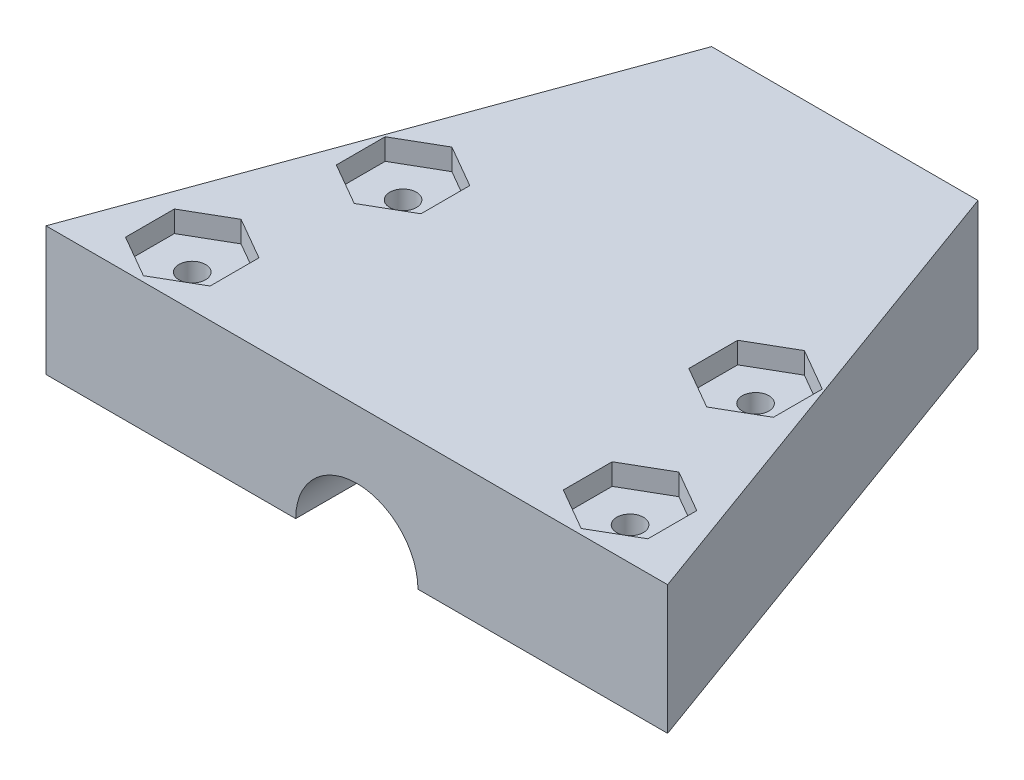
from build123d import *

# Parameters (mm, degrees)
BOSS_EXTRUDE3_DEPTH              = 14.5
SKETCH8_R                        = 6.884606738
CUT_EXTRUDE3_DEPTH               = 88
CUT_EXTRUDE4_DEPTH               = 2.4
CUT_EXTRUDE5_DEPTH               = 2.4
F_39_0_11811024_DIAMETER_HOLE1_D = 3.000000096


with BuildPart() as part:
    # Sketch6 → Boss-Extrude3 (new body)
    with BuildSketch(Plane(origin=(0, 0, 0), x_dir=(1, 0, 0), z_dir=(0, 1, 0))):
        Polygon((-16.836914056, 5.783353512), (13.163085944, 5.783353512), (33.163085944, -49.166194877), (-36.836914056, -49.166194877), align=None)
    extrude(amount=BOSS_EXTRUDE3_DEPTH)

    # Sketch8 → Cut-Extrude3 (cut)
    with BuildSketch(Plane.XY.offset(49.166194877)):
        with Locations((-1.836914056, 0)):
            Circle(SKETCH8_R)
    extrude(amount=-CUT_EXTRUDE3_DEPTH, mode=Mode.SUBTRACT)

    # Sketch9 → Cut-Extrude4 (cut)
    with BuildSketch(Plane(origin=(0, 14.5, 0), x_dir=(1, 0, 0), z_dir=(0, 1, 0))):
        Polygon((-21.661914056, -29.63287332), (-16.898774335, -26.88287332), (-16.898774335, -21.38287332), (-21.661914056, -18.63287332), (-26.425053777, -21.38287332), (-26.425053777, -26.88287332), align=None)
        Polygon((-26.486914056, -48.549100152), (-21.723774335, -45.799100152), (-21.723774335, -40.299100152), (-26.486914056, -37.549100152), (-31.250053777, -40.299100152), (-31.250053777, -45.799100152), align=None)
        Polygon((22.813085944, -48.549100152), (27.576225665, -45.799100152), (27.576225665, -40.299100152), (22.813085944, -37.549100152), (18.049946223, -40.299100152), (18.049946223, -45.799100152), align=None)
        Polygon((18.031463076, -29.63287332), (22.794602796, -26.88287332), (22.794602796, -21.38287332), (18.031463076, -18.63287332), (13.268323355, -21.38287332), (13.268323355, -26.88287332), align=None)
    extrude(amount=-CUT_EXTRUDE4_DEPTH, mode=Mode.SUBTRACT)

    # Sketch10 → Cut-Extrude5 (cut)
    with BuildSketch(Plane.XZ):
        Polygon((-26.486914056, 37.549100152), (-21.723774335, 40.299100152), (-21.723774335, 45.799100152), (-26.486914056, 48.549100152), (-31.250053777, 45.799100152), (-31.250053777, 40.299100152), align=None)
        Polygon((-21.661914056, 18.63287332), (-16.898774335, 21.38287332), (-16.898774335, 26.88287332), (-21.661914056, 29.63287332), (-26.425053777, 26.88287332), (-26.425053777, 21.38287332), align=None)
        Polygon((18.031463076, 18.63287332), (22.794602796, 21.38287332), (22.794602796, 26.88287332), (18.031463076, 29.63287332), (13.268323355, 26.88287332), (13.268323355, 21.38287332), align=None)
        Polygon((22.813085944, 37.549100152), (27.576225665, 40.299100152), (27.576225665, 45.799100152), (22.813085944, 48.549100152), (18.049946223, 45.799100152), (18.049946223, 40.299100152), align=None)
    extrude(amount=-CUT_EXTRUDE5_DEPTH, mode=Mode.SUBTRACT)

    # #39 (0.11811024) Diameter Hole1 (through all)
    with Locations(Plane(origin=(-21.661914056, 14.5, 24.13287332), x_dir=(0, 0, 1), z_dir=(0, 1, 0))):
        with Locations((0, 0), (0, 39.693377132), (18.916226832, -4.825), (18.916226832, 44.475)):
            Hole(F_39_0_11811024_DIAMETER_HOLE1_D / 2)


solid = part.part
